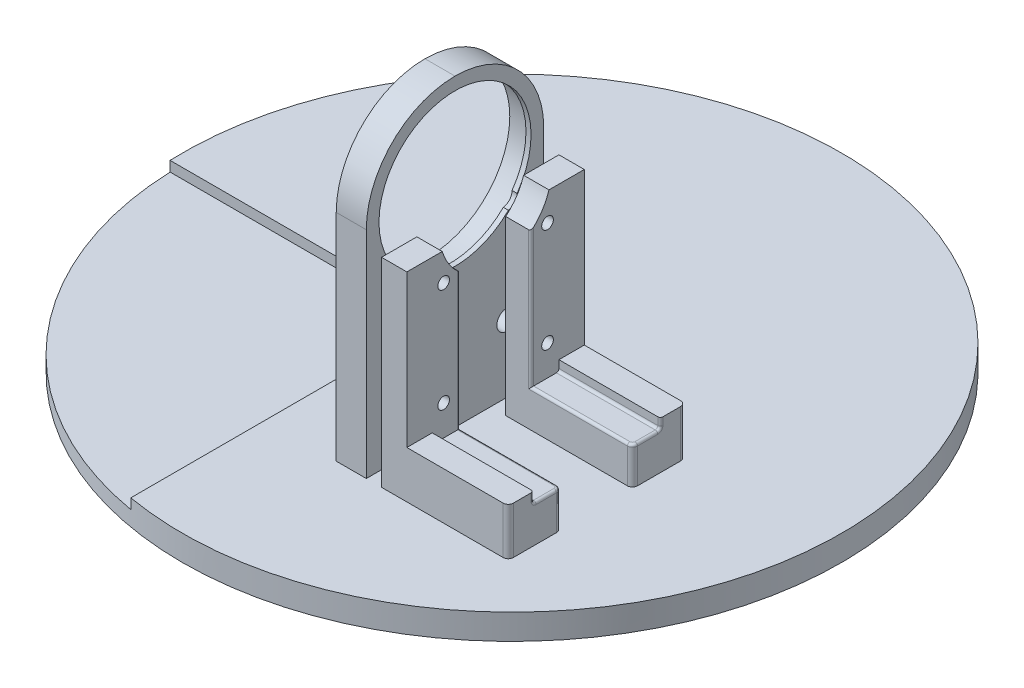
from build123d import *

# Parameters (mm, degrees)
SKETCH_1_R           = 65
EXTRUDE_1_DEPTH      = 5
SKETCH_2_W           = 6
SKETCH_2_H           = 35
EXTRUDE_2_DEPTH      = 60
FILLET_1_R           = 17.5
SKETCH_3_R           = 16
CUT_EXTRUDE_1_DEPTH  = 5
CHAMFER_1_SIZE       = 1.640243073
CHAMFER_1_SIZE_2     = 0.8
SKETCH_4_R           = 15
CUT_EXTRUDE_2_DEPTH  = 118.234882236
SKETCH_6_W           = 2
SKETCH_6_H           = 6
CUT_EXTRUDE_3_DEPTH  = 118.858124934
SKETCH_8_R           = 1.6
CUT_EXTRUDE_5_DEPTH  = 6
CUT_EXTRUDE_START    = -2
CUT_EXTRUDE_8_DEPTH  = 2.2
SKETCH_11_W          = 25
SKETCH_11_H          = 10.5
EXTRUDE_4_DEPTH      = 7.3
EXTRUDE_5_DEPTH      = 2
FILLET_3_R           = 1
EXTRUDE_6_DEPTH      = 5
SKETCH_14_R          = 1.15
CUT_EXTRUDE_10_DEPTH = 124.023158848
FILLET_2_R           = 0.5
SKETCH_15_R          = 2
CUT_EXTRUDE_11_DEPTH = 10
SKETCH_16_W          = 53.828401117
SKETCH_16_H          = 62.5
CUT_EXTRUDE_12_DEPTH = 2


# Some blends are built 0.0001 mm under size
with BuildPart() as part:
    # 스케치1 → 보스-돌출1 (new body)
    with BuildSketch(Plane(origin=(0, 0, 0), x_dir=(1, 0, 0), z_dir=(0, 1, 0))):
        with Locations(Location((0, 0, 0), (0, 0, 270))):
            Circle(SKETCH_1_R)
    extrude(amount=EXTRUDE_1_DEPTH)

    # 스케치2 → 보스-돌출2 (add)
    with BuildSketch(Plane(origin=(0, 5, 0), x_dir=(1, 0, 0), z_dir=(0, 1, 0))):
        with Locations((5.76, -20)):
            Rectangle(SKETCH_2_W, SKETCH_2_H)
    extrude(amount=EXTRUDE_2_DEPTH)

    # 필렛1
    fillet_1_edges = [part.edges().sort_by_distance(p)[0] for p in [
        (5.76, 65, 2.5),
        (5.76, 65, 37.5),
    ]]
    fillet(fillet_1_edges, radius=FILLET_1_R - 0.0001)  # a hair under: the kernel refuses the full size

    # 스케치3 → 컷-돌출1 (cut)
    with BuildSketch(Plane.ZY.offset(-2.76)):
        with Locations((20, 47.5)):
            Circle(SKETCH_3_R)
    extrude(amount=-CUT_EXTRUDE_1_DEPTH, mode=Mode.SUBTRACT)

    # 모따기1
    # the kernel refuses this chamfer: 1.640243073, 0.8 mm, written as the material it takes off along each edge
    with BuildSketch(Plane(origin=(2.76, 47.5, 20), x_dir=(0, 0, 1), z_dir=(0, -1, 0))) as chamfer_1_piece_1:
        Polygon((16 + CHAMFER_1_SIZE, 0), (16, -CHAMFER_1_SIZE_2), (16, 0), align=None)
    revolve(axis=Axis((2.76, 47.5, 20), (-1, 0, 0)), mode=Mode.SUBTRACT)

    # 스케치4 → 컷-돌출2 (cut, through all)
    with BuildSketch(Plane.ZY.offset(-7.76)):
        with Locations((20, 47.5)):
            Circle(SKETCH_4_R)
    extrude(amount=-CUT_EXTRUDE_2_DEPTH, mode=Mode.SUBTRACT)

    # 스케치6 → 컷-돌출3 (cut, through all)
    with BuildSketch(Plane(origin=(8.76, 0, 0), x_dir=(0, 0, -1), z_dir=(1, 0, 0))):
        with Locations((-3.5, 24.5)):
            Rectangle(SKETCH_6_W, SKETCH_6_H)
    extrude(amount=-CUT_EXTRUDE_3_DEPTH, mode=Mode.SUBTRACT)

    # 스케치8 → 컷-돌출5 (cut)
    with BuildSketch(Plane(origin=(0, 0, 4.5), x_dir=(-1, 0, 0), z_dir=(0, 0, -1))):
        with Locations((-5.76, 24.5)):
            Circle(SKETCH_8_R)
    extrude(amount=-CUT_EXTRUDE_5_DEPTH, mode=Mode.SUBTRACT)

    # 스케치9 → 컷-돌출8 (cut)
    with BuildSketch(Plane(origin=(0, 0, 4.5), x_dir=(-1, 0, 0), z_dir=(0, 0, -1)).offset(CUT_EXTRUDE_START)):
        Polygon((-4.316624327, 27), (-7.203375673, 27), (-8.646751346, 24.5), (-7.203375673, 22), (-4.316624327, 22), (-2.76, 22), (-2.76, 27), align=None)
    extrude(amount=-CUT_EXTRUDE_8_DEPTH, mode=Mode.SUBTRACT)

    # 스케치11 → 보스-돌출4 (add)
    with BuildSketch(Plane(origin=(0, 5, 0), x_dir=(1, 0, 0), z_dir=(0, 1, 0))):
        with Locations((24.26, -7.75)):
            Rectangle(SKETCH_11_W, SKETCH_11_H)
        with Locations((24.26, -32.25)):
            Rectangle(SKETCH_11_W, SKETCH_11_H)
    extrude(amount=EXTRUDE_4_DEPTH)

    # 스케치12 → 보스-돌출5 (add)
    with BuildSketch(Plane(origin=(0, 12.3, 0), x_dir=(1, 0, 0), z_dir=(0, 1, 0))):
        Polygon((16.76, -32.5), (36.76, -32.5), (36.76, -37.5), (11.76, -37.5), (11.76, -27), (16.76, -27), align=None)
        Polygon((11.76, -2.5), (36.76, -2.5), (36.76, -7.5), (16.76, -7.5), (16.76, -13), (11.76, -13), align=None)
    extrude(amount=EXTRUDE_5_DEPTH)

    # 필렛3
    fillet_3_edges = [part.edges().sort_by_distance(p)[0] for p in [
        (36.76, 9.65, 2.5),
        (36.76, 9.65, 37.5),
        (36.76, 8.65, 27),
        (36.76, 8.65, 13),
    ]]
    fillet(fillet_3_edges, radius=FILLET_3_R)

    # 스케치13 → 보스-돌출6 (add)
    with BuildSketch(Plane(origin=(16.76, 0, 0), x_dir=(0, 0, -1), z_dir=(1, 0, 0))):
        with BuildLine():
            Line((-27, 14.3), (-37.5, 14.3))
            Line((-37.5, 14.3), (-37.5, 44.3))
            Line((-37.5, 44.3), (-30.524257694, 44.3))
            ThreePointArc((-30.524257694, 44.3), (-29.151964364, 41.397414624), (-27, 39.014718626))
            Line((-27, 39.014718626), (-27, 14.3))
        make_face()
        with BuildLine():
            Line((-13, 14.3), (-2.5, 14.3))
            Line((-2.5, 14.3), (-2.5, 44.3))
            Line((-2.5, 44.3), (-9.475742306, 44.3))
            ThreePointArc((-9.475742306, 44.3), (-10.848035636, 41.397414624), (-13, 39.014718626))
            Line((-13, 39.014718626), (-13, 14.3))
        make_face()
    extrude(amount=-EXTRUDE_6_DEPTH)

    # 스케치14 → 컷-돌출10 (cut, through all)
    with BuildSketch(Plane(origin=(16.76, 0, 0), x_dir=(0, 0, -1), z_dir=(1, 0, 0))):
        with Locations((-30.25, 18.3)):
            Circle(SKETCH_14_R)
        with Locations((-9.75, 18.3)):
            Circle(SKETCH_14_R)
        with Locations((-9.75, 38.8)):
            Circle(SKETCH_14_R)
        with Locations((-30.25, 38.8)):
            Circle(SKETCH_14_R)
    extrude(amount=-CUT_EXTRUDE_10_DEPTH, mode=Mode.SUBTRACT)

    # 필렛2
    fillet_2_edges = [part.edges().sort_by_distance(p)[0] for p in [
        (26.26, 12.3, 13),
        (16.76, 25.657359313, 13),
        (26.76, 12.3, 7.5),
        (36.76, 13.3, 7.5),
        (36.76, 12.3, 30.25),
        (16.76, 25.657359313, 27),
        (26.76, 12.3, 32.5),
        (36.76, 13.3, 32.5),
        (26.26, 12.3, 27),
        (36.467106781, 12.3, 27.292893219),
        (36.76, 12.3, 9.75),
        (36.467106781, 12.3, 12.707106781),
    ]]
    fillet(fillet_2_edges, radius=FILLET_2_R)

    # 스케치15 → 컷-돌출11 (cut)
    with BuildSketch(Plane.ZY.offset(-2.76)):
        with Locations((9.75, 38.8)):
            Circle(SKETCH_15_R)
        with Locations((30.25, 38.8)):
            Circle(SKETCH_15_R)
        with Locations((9.75, 18.3)):
            Circle(SKETCH_15_R)
        with Locations((30.25, 18.3)):
            Circle(SKETCH_15_R)
    extrude(amount=-CUT_EXTRUDE_11_DEPTH, mode=Mode.SUBTRACT)

    # 스케치16 → 컷-돌출12 (cut)
    with BuildSketch(Plane(origin=(0, 5, 0), x_dir=(1, 0, 0), z_dir=(0, 1, 0))):
        with Locations((-38.085799442, -33.75)):
            Rectangle(SKETCH_16_W, SKETCH_16_H)
    extrude(amount=-CUT_EXTRUDE_12_DEPTH, mode=Mode.SUBTRACT)


solid = part.part
